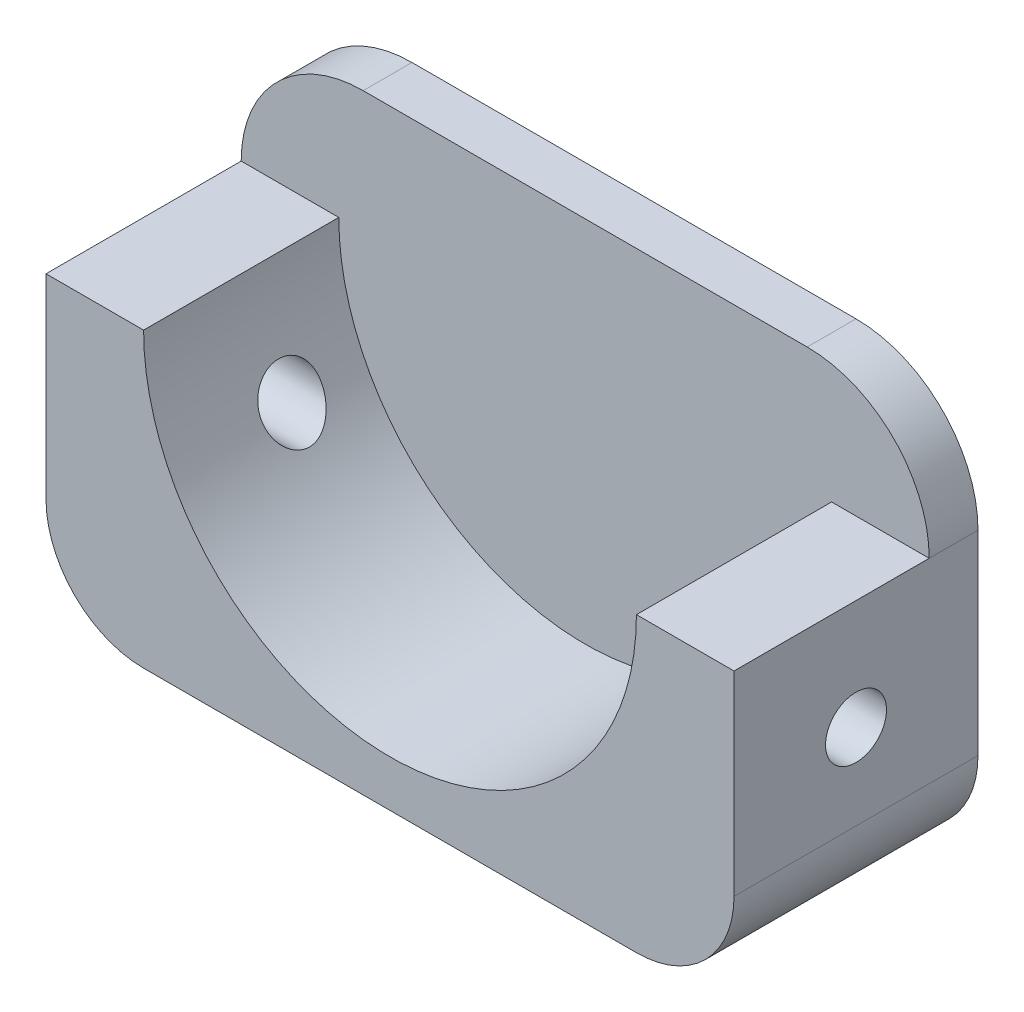
from build123d import *

# Parameters (mm, degrees)
EXTRUDE_1_DEPTH     = 8
EXTRUDE_2_DEPTH     = 2
SKETCH_3_R          = 1.25
CUT_EXTRUDE_1_DEPTH = 32.673964071
FILLET_1_R          = 5
FILLET_2_R          = 4


with BuildPart() as part:
    # 草图1 → 凸台-拉伸1 (new body)
    with BuildSketch(Plane.XY):
        with BuildLine():
            Line((-10.1, 0), (-14.1, 0))
            Line((-14.1, 0), (-14.1, -12))
            Line((-14.1, -12), (14.1, -12))
            Line((14.1, -12), (14.1, 0))
            Line((14.1, 0), (10.1, 0))
            ThreePointArc((10.1, 0), (0, -10.1), (-10.1, 0))
        make_face()
    extrude(amount=EXTRUDE_1_DEPTH)

    # 草图2 → 凸台-拉伸2 (add)
    with BuildSketch(Plane(origin=(0, 0, 0), x_dir=(-1, 0, 0), z_dir=(0, 0, -1))):
        with BuildLine():
            Line((-14.1, -12), (-14.1, 0))
            ThreePointArc((-14.1, 0), (-13.869033835, 2.541633427), (-13.18370206, 5))
            Line((-13.18370206, 5), (13.18370206, 5))
            ThreePointArc((13.18370206, 5), (13.869033835, 2.541633427), (14.1, 0))
            Line((14.1, 0), (14.1, -12))
            Line((14.1, -12), (-14.1, -12))
        make_face()
    extrude(amount=EXTRUDE_2_DEPTH)

    # 草图3 → 切除-拉伸1 (cut, through all)
    with BuildSketch(Plane.ZY.offset(14.1)):
        with Locations(Location((3, -4.5, 0), (0, 0, 270))):
            Circle(SKETCH_3_R)
    extrude(amount=-CUT_EXTRUDE_1_DEPTH, mode=Mode.SUBTRACT)

    # 圆角1
    fillet_1_edges = [part.edges().sort_by_distance(p)[0] for p in [
        (-13.18370206, 5, -1),
        (13.18370206, 5, -1),
    ]]
    fillet(fillet_1_edges, radius=FILLET_1_R - 0.0001)  # a hair under: the kernel refuses the full size

    # 圆角2
    fillet_2_edges = [part.edges().sort_by_distance(p)[0] for p in [
        (14.1, -12, 3),
        (-14.1, -12, 3),
    ]]
    fillet(fillet_2_edges, radius=FILLET_2_R)


solid = part.part
